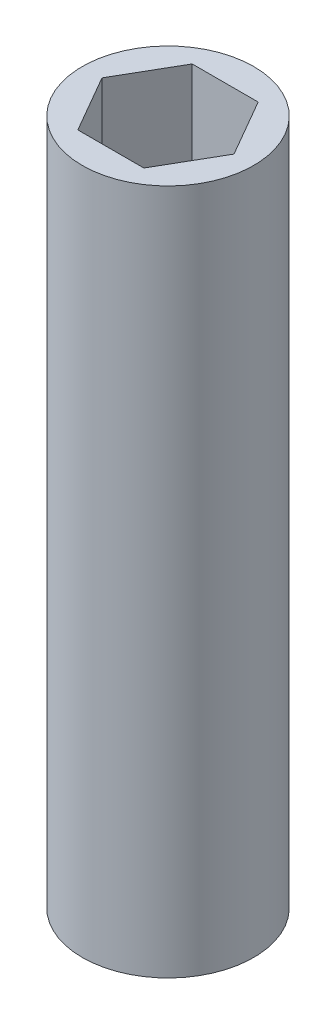
from build123d import *

# Parameters (mm, degrees)
SKETCH1_R           = 9.525
BOSS_EXTRUDE1_DEPTH = 76.2


with BuildPart() as part:
    # Sketch1 → Boss-Extrude1 (new body)
    with BuildSketch(Plane(origin=(0, 0, 0), x_dir=(1, 0, 0), z_dir=(0, 1, 0))):
        Circle(SKETCH1_R)
        Polygon((3.666174209, 6.35), (-3.666174209, 6.35), (-7.332348419, 0), (-3.666174209, -6.35), (3.666174209, -6.35), (7.332348419, 0), align=None, mode=Mode.SUBTRACT)
    extrude(amount=BOSS_EXTRUDE1_DEPTH)


solid = part.part
